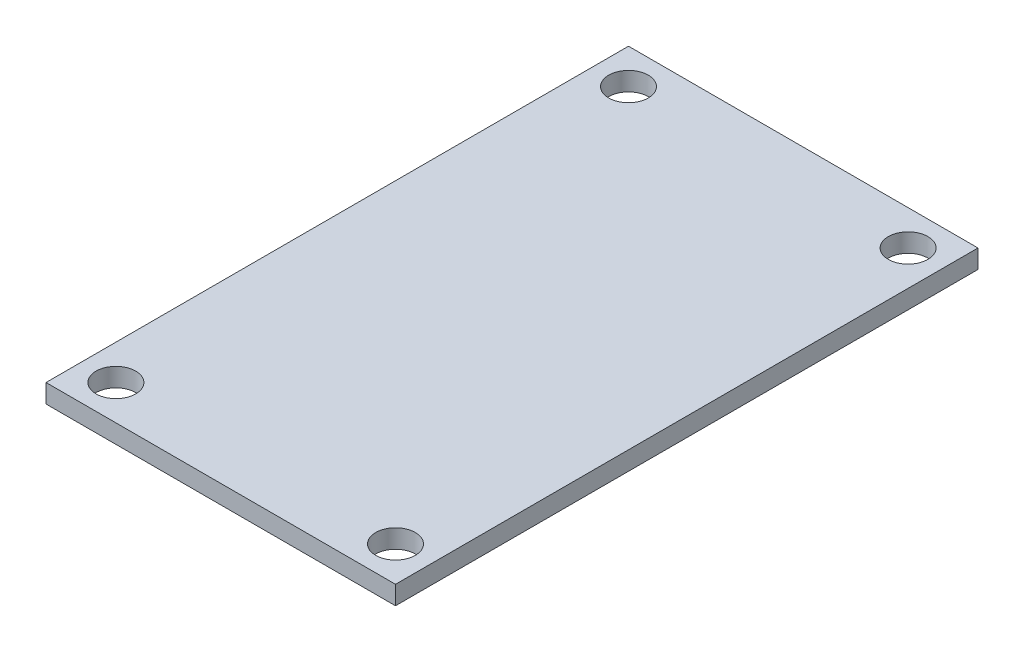
from build123d import *

# Parameters (mm, degrees)
SKETCH1_W           = 30
SKETCH1_H           = 50
SKETCH1_R           = 1.7
BOSS_EXTRUDE1_DEPTH = 1.6


with BuildPart() as part:
    # Sketch1 → Boss-Extrude1 (new body)
    with BuildSketch(Plane(origin=(0, 0, 0), x_dir=(1, 0, 0), z_dir=(0, 1, 0))):
        with Locations((15, 25)):
            Rectangle(SKETCH1_W, SKETCH1_H)
        with Locations((3, 3)):
            Circle(SKETCH1_R, mode=Mode.SUBTRACT)
        with Locations((27, 3)):
            Circle(SKETCH1_R, mode=Mode.SUBTRACT)
        with Locations((3, 47)):
            Circle(SKETCH1_R, mode=Mode.SUBTRACT)
        with Locations((27, 47)):
            Circle(SKETCH1_R, mode=Mode.SUBTRACT)
    extrude(amount=BOSS_EXTRUDE1_DEPTH)


solid = part.part
